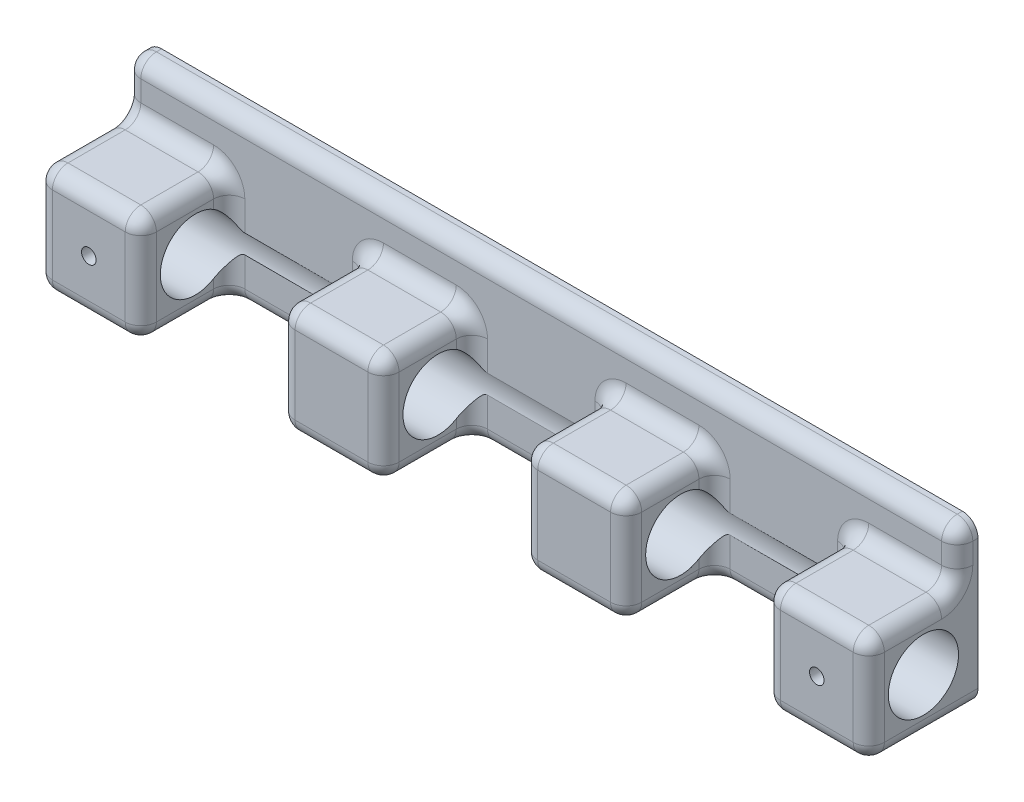
from build123d import *

# Parameters (mm, degrees)
SKETCH1_W           = 160
SKETCH1_H           = 21
BOSS_EXTRUDE1_DEPTH = 21
SKETCH2_W           = 26.666666667
SKETCH2_H           = 21
SKETCH2_W_2         = 26.666666666
CUT_EXTRUDE1_DEPTH  = 17
SKETCH3_R           = 6.75
CUT_EXTRUDE2_DEPTH  = 169
SKETCH4_W           = 160
SKETCH4_H           = 10
BOSS_EXTRUDE2_DEPTH = 4
FILLET1_R           = 3
CUT_EXTRUDE3_DEPTH  = 0.5
SKETCH6_R           = 1.4
CUT_EXTRUDE4_DEPTH  = 10


# Read off the part's stored shape, not the designer's step: Cut-Extrude3
with BuildPart() as part:
    # Sketch1 → Boss-Extrude1 (new body)
    with BuildSketch(Plane.XY):
        with Locations((80, 10.5)):
            Rectangle(SKETCH1_W, SKETCH1_H)
    extrude(amount=BOSS_EXTRUDE1_DEPTH)

    # Sketch2 → Cut-Extrude1 (cut)
    with BuildSketch(Plane.XY.offset(21)):
        with Locations((33.333333334, 10.5)):
            Rectangle(SKETCH2_W, SKETCH2_H)
        with Locations((80, 10.5)):
            Rectangle(SKETCH2_W_2, SKETCH2_H)
        with Locations((126.666666667, 10.5)):
            Rectangle(SKETCH2_W, SKETCH2_H)
    extrude(amount=-CUT_EXTRUDE1_DEPTH, mode=Mode.SUBTRACT)

    # Sketch3 → Cut-Extrude2 (cut)
    with BuildSketch(Plane(origin=(160, 0, 0), x_dir=(0, 0, -1), z_dir=(1, 0, 0))):
        with Locations((-10.5, 10.5)):
            Circle(SKETCH3_R)
    extrude(amount=-CUT_EXTRUDE2_DEPTH, mode=Mode.SUBTRACT)

    # Sketch4 → Boss-Extrude2 (add)
    with BuildSketch(Plane(origin=(0, 0, 0), x_dir=(-1, 0, 0), z_dir=(0, 0, -1))):
        with Locations((-80, 26)):
            Rectangle(SKETCH4_W, SKETCH4_H)
    extrude(amount=-BOSS_EXTRUDE2_DEPTH)

    # Fillet1
    fillet1_edges = [part.edges().sort_by_distance(p)[0] for p in [
        (160, 10.5, 21),
        (56.666666667, 0, 21),
        (103.333333333, 0, 21),
        (150, 0, 21),
        (150, 21, 21),
        (103.333333333, 21, 21),
        (56.666666667, 21, 21),
        (10, 21, 21),
        (46.666666667, 10.5, 21),
        (46.666666667, 21, 12.5),
        (33.333333333, 0, 4),
        (46.666666667, 0, 12.5),
        (20, 16.660013736, 4),
        (20, 0, 12.5),
        (20, 21, 12.5),
        (46.666666667, 16.660013736, 4),
        (20, 10.5, 21),
        (93.333333333, 10.5, 21),
        (93.333333333, 21, 12.5),
        (80, 0, 4),
        (93.333333333, 0, 12.5),
        (66.666666667, 16.660013736, 4),
        (66.666666667, 0, 12.5),
        (66.666666667, 21, 12.5),
        (93.333333333, 16.660013736, 4),
        (66.666666667, 10.5, 21),
        (113.333333333, 21, 12.5),
        (140, 10.5, 21),
        (140, 21, 12.5),
        (126.666666667, 0, 4),
        (140, 0, 12.5),
        (113.333333333, 16.660013736, 4),
        (113.333333333, 0, 12.5),
        (140, 16.660013736, 4),
        (113.333333333, 10.5, 21),
        (0, 10.5, 21),
        (46.666666667, 4.339986264, 4),
        (20, 4.339986264, 4),
        (93.333333333, 4.339986264, 4),
        (66.666666667, 4.339986264, 4),
        (113.333333333, 4.339986264, 4),
        (140, 4.339986264, 4),
        (0, 21, 12.5),
        (160, 21, 12.5),
        (160, 0, 10.5),
        (0, 0, 10.5),
        (10, 0, 21),
        (10, 21, 4),
        (56.666666667, 21, 4),
        (103.333333333, 21, 4),
        (150, 21, 4),
        (0, 26, 4),
        (0, 31, 2),
        (80, 31, 4),
        (160, 31, 2),
        (160, 26, 4),
    ]]
    fillet(fillet1_edges, radius=FILLET1_R)

    # Cut-Extrude3 outline → Cut-Extrude3 (cut)
    with BuildSketch(Plane(origin=(0, 0, 0), x_dir=(1, 0, 0), z_dir=(0, 1, 0))):
        with BuildLine():
            Line((11.336700439, -3.655393473), (11.73520244, -3.655393473))
            add(Edge.make_bspline(
                [(11.73520244, -3.655393473), (11.792609612, -3.656955892), (11.903128001, -3.659963809), (12.061113993, -3.691041143), (12.205058118, -3.738664353), (12.312958481, -3.795944591), (12.388696008, -3.851752334), (12.4384082, -3.897749124), (12.4795519, -3.950102336), (12.513019482, -4.006683652), (12.539610909, -4.067920614), (12.559175264, -4.133571655), (12.569371354, -4.204744225), (12.570953712, -4.253600275), (12.571767171, -4.278716214)],
                knots=[0, 0, 0, 0, 0.14645993, 0.281959809, 0.409516764, 0.532647863, 0.591962027, 0.649497283, 0.705051259, 0.761407303, 0.816961279, 0.875190283, 0.935837768, 1, 1, 1, 1], degree=3))
            add(Edge.make_bspline(
                [(12.571767171, -4.278716214), (12.571332812, -4.303515564), (12.570494294, -4.351390035), (12.560578497, -4.420958408), (12.544143921, -4.485559431), (12.522151043, -4.546046778), (12.493000395, -4.601595874), (12.456913014, -4.651861137), (12.415157732, -4.697976153), (12.34977982, -4.751815634), (12.256914984, -4.809168429), (12.129871995, -4.855844559), (11.989064772, -4.885698406), (11.890071576, -4.888828073), (11.838446299, -4.890460205)],
                knots=[0, 0, 0, 0, 0.068776482, 0.132771132, 0.194465133, 0.253486546, 0.31097645, 0.36793738, 0.424793325, 0.483074522, 0.602472741, 0.725634574, 0.856917531, 1, 1, 1, 1], degree=3))
            add(Edge.make_bspline(
                [(11.838446299, -4.890460205), (11.786200385, -4.888737107), (11.685029918, -4.88540045), (11.539840628, -4.856043809), (11.40747776, -4.807573422), (11.288074895, -4.739424737), (11.182416287, -4.650821644), (11.09005667, -4.543267537), (11.011011745, -4.416149967), (10.971311733, -4.321807973), (10.950742086, -4.272926839)],
                knots=[0, 0, 0, 0, 0.134952381, 0.261325611, 0.38102363, 0.497972692, 0.614862627, 0.735710233, 0.863064339, 1, 1, 1, 1], degree=3))
            Line((10.950742086, -4.272926839), (10.209702047, -4.396433512))
            add(Edge.make_bspline(
                [(10.209702047, -4.396433512), (10.220767303, -4.436594563), (10.242725657, -4.51629182), (10.290291457, -4.630488451), (10.345860003, -4.740107996), (10.412668079, -4.843425632), (10.48978863, -4.940476472), (10.576108273, -5.032619657), (10.672531511, -5.119665981), (10.779530392, -5.199120935), (10.894152868, -5.27115452), (11.014641469, -5.335491301), (11.142016958, -5.388064398), (11.273925102, -5.432954472), (11.412178333, -5.466642702), (11.55570901, -5.490420391), (11.70529571, -5.505389086), (11.806890507, -5.507113851), (11.858709113, -5.507993571)],
                knots=[0, 0, 0, 0, 0.058194274, 0.115483133, 0.172604059, 0.229861137, 0.287172939, 0.34571544, 0.406218448, 0.468549055, 0.531807232, 0.595376365, 0.659270767, 0.724262021, 0.790032789, 0.857977019, 0.927560927, 1, 1, 1, 1], degree=3))
            add(Edge.make_bspline(
                [(11.858709113, -5.507993571), (11.910216525, -5.50721274), (12.011542355, -5.505676681), (12.16005465, -5.489260165), (12.303085683, -5.465745223), (12.440359149, -5.431113981), (12.571589014, -5.385173018), (12.697994502, -5.331582641), (12.817720761, -5.266317473), (12.931204942, -5.192826211), (13.034669854, -5.11082465), (13.12589704, -5.021376331), (13.202464044, -4.924282256), (13.265687037, -4.820759457), (13.314643946, -4.710105636), (13.348887967, -4.592971059), (13.371248941, -4.469005599), (13.373439288, -4.383989895), (13.374560547, -4.340469551)],
                knots=[0, 0, 0, 0, 0.072329196, 0.142286625, 0.209660341, 0.275850978, 0.340866839, 0.404823711, 0.468507074, 0.532171199, 0.59455088, 0.653658678, 0.711240855, 0.76780896, 0.82364145, 0.880682169, 0.938920073, 1, 1, 1, 1], degree=3))
            add(Edge.make_bspline(
                [(13.374560547, -4.340469551), (13.373879877, -4.307941499), (13.372541028, -4.243960144), (13.360173625, -4.150173693), (13.342754454, -4.05971486), (13.314673391, -3.973636494), (13.281666244, -3.889984125), (13.238498374, -3.811065066), (13.189032677, -3.735074198), (13.132559309, -3.663344596), (13.070560128, -3.597487303), (13.004361842, -3.538529252), (12.933779309, -3.488730733), (12.860448386, -3.445768968), (12.783059149, -3.411553958), (12.702109058, -3.385890703), (12.617511768, -3.366955774), (12.559633861, -3.361150255), (12.530276648, -3.358205541)],
                knots=[0, 0, 0, 0, 0.068303902, 0.134350996, 0.198493545, 0.261541094, 0.324283713, 0.38716809, 0.450143171, 0.514626529, 0.578683592, 0.639964526, 0.700529663, 0.759872367, 0.818260933, 0.877883838, 0.938059436, 1, 1, 1, 1], degree=3))
            add(Edge.make_bspline(
                [(12.530276648, -3.358205541), (12.565765439, -3.351972808), (12.635691734, -3.339691976), (12.737413443, -3.312495571), (12.834108569, -3.278024519), (12.924944475, -3.235229795), (13.010558554, -3.186078377), (13.090187871, -3.128581353), (13.16435095, -3.06357771), (13.233903346, -2.992930493), (13.294975075, -2.915634012), (13.349805234, -2.835048014), (13.396459376, -2.750372645), (13.432647718, -2.660965919), (13.462137401, -2.568458117), (13.483140492, -2.472233332), (13.496202001, -2.371799666), (13.497437208, -2.303615223), (13.49806722, -2.268838088)],
                knots=[0, 0, 0, 0, 0.067664265, 0.133324108, 0.197541938, 0.26025261, 0.321707795, 0.382745724, 0.444417359, 0.506801167, 0.56870324, 0.629200468, 0.689767054, 0.74991022, 0.810104959, 0.871971636, 0.934699771, 1, 1, 1, 1], degree=3))
            add(Edge.make_bspline(
                [(13.49806722, -2.268838088), (13.496991709, -2.221459448), (13.494872133, -2.128087472), (13.47146804, -1.991663312), (13.436232095, -1.861342078), (13.385703572, -1.737815951), (13.32005713, -1.621498079), (13.241868761, -1.510273423), (13.146960175, -1.407358493), (13.040648766, -1.31006713), (12.921798768, -1.222218715), (12.792423736, -1.145931264), (12.653283607, -1.082629571), (12.505907808, -1.028462677), (12.348158534, -0.989182538), (12.181652863, -0.958641805), (12.00541306, -0.941468999), (11.884796705, -0.939338212), (11.823007965, -0.938246663)],
                knots=[0, 0, 0, 0, 0.059249793, 0.116767182, 0.172734877, 0.22798553, 0.283318266, 0.339620909, 0.397766126, 0.458186184, 0.519785852, 0.582412393, 0.645820863, 0.710899592, 0.778667479, 0.849031026, 0.922662372, 1, 1, 1, 1], degree=3))
            add(Edge.make_bspline(
                [(11.823007965, -0.938246663), (11.765721177, -0.939406896), (11.653480619, -0.94168011), (11.4889191, -0.958067707), (11.332234666, -0.986189016), (11.182910129, -1.02439982), (11.041211406, -1.074948195), (10.907095673, -1.136453852), (10.780795077, -1.209597153), (10.662674083, -1.29198516), (10.55479494, -1.382687771), (10.455530391, -1.476192669), (10.367636087, -1.573816345), (10.289950021, -1.674805329), (10.221898813, -1.778567213), (10.166310965, -1.886678441), (10.118381716, -1.996708039), (10.096914776, -2.073309517), (10.086195374, -2.111560059)],
                knots=[0, 0, 0, 0, 0.076218491, 0.149332965, 0.219763044, 0.287854293, 0.354179751, 0.419667397, 0.483895657, 0.548123916, 0.611026849, 0.671264617, 0.729443883, 0.785595192, 0.840672964, 0.894269413, 0.947203993, 1, 1, 1, 1], degree=3))
            Line((10.086195374, -2.111560059), (10.888988749, -2.296820068))
            add(Edge.make_bspline(
                [(10.888988749, -2.296820068), (10.898579592, -2.266775269), (10.917345058, -2.207989537), (10.95131144, -2.123894805), (10.988920409, -2.045519874), (11.030303319, -1.97259484), (11.076760719, -1.905950509), (11.127124132, -1.845310289), (11.180315143, -1.788996797), (11.23936025, -1.740577896), (11.301342493, -1.696583372), (11.367492341, -1.658581866), (11.437809181, -1.627165813), (11.511912279, -1.600629139), (11.590118657, -1.580622238), (11.672689013, -1.566153879), (11.759135521, -1.557407598), (11.818163276, -1.556327652), (11.848095258, -1.555780029)],
                knots=[0, 0, 0, 0, 0.071896185, 0.140672259, 0.20660537, 0.27000996, 0.331655297, 0.391566041, 0.449658052, 0.507971859, 0.565351171, 0.622842864, 0.681597752, 0.74074953, 0.8021194, 0.865422108, 0.931757812, 1, 1, 1, 1], degree=3))
            add(Edge.make_bspline(
                [(11.848095258, -1.555780029), (11.878994819, -1.556259028), (11.93966634, -1.557199545), (12.028152735, -1.566809572), (12.111928068, -1.583548282), (12.191084389, -1.60549711), (12.266105182, -1.633652106), (12.336645693, -1.667937835), (12.401613285, -1.710354349), (12.462342253, -1.757107762), (12.51651626, -1.808890276), (12.565088166, -1.863049347), (12.603880029, -1.921710265), (12.638631368, -1.980877091), (12.66372698, -2.044130644), (12.682137924, -2.109403424), (12.692892453, -2.177787213), (12.694471818, -2.2240947), (12.695273844, -2.247610378)],
                knots=[0, 0, 0, 0, 0.075928534, 0.149086252, 0.218387932, 0.285713599, 0.350758935, 0.415103929, 0.478039756, 0.541134261, 0.603205207, 0.662029822, 0.719478482, 0.775762225, 0.830372208, 0.886187655, 0.94220428, 1, 1, 1, 1], degree=3))
            add(Edge.make_bspline(
                [(12.695273844, -2.247610378), (12.693039752, -2.294851098), (12.688630363, -2.38808926), (12.648027399, -2.522521793), (12.583022459, -2.647569527), (12.508527724, -2.741540919), (12.437578255, -2.809714588), (12.376129826, -2.854267112), (12.308072559, -2.892071589), (12.233500444, -2.922751871), (12.152701577, -2.946921065), (12.065525737, -2.964395483), (11.971793943, -2.973484433), (11.907292607, -2.975216644), (11.874147447, -2.976106771)],
                knots=[0, 0, 0, 0, 0.114482462, 0.225951983, 0.337738459, 0.455083819, 0.515304714, 0.576230561, 0.638815901, 0.703942349, 0.771645187, 0.843330546, 0.919492609, 1, 1, 1, 1], degree=3))
            Line((11.874147447, -2.976106771), (11.336700439, -2.976106771))
            Line((11.336700439, -2.976106771), (11.336700439, -3.655393473))
        make_face()
        Polygon((9.931812032, -5.446240234), (8.537537479, -1), (7.723165353, -1), (6.319241842, -5.446240234), (7.165455532, -5.446240234), (8.218156942, -2.112524954), (9.263139184, -5.446240234), align=None)
    extrude(amount=CUT_EXTRUDE3_DEPTH, mode=Mode.SUBTRACT)

    # Sketch6 → Cut-Extrude4 (cut)
    with BuildSketch(Plane.XY.offset(21)):
        with Locations((10, 10.5)):
            Circle(SKETCH6_R)
        with Locations((150, 10.5)):
            Circle(SKETCH6_R)
    extrude(amount=-CUT_EXTRUDE4_DEPTH, mode=Mode.SUBTRACT)


solid = part.part
